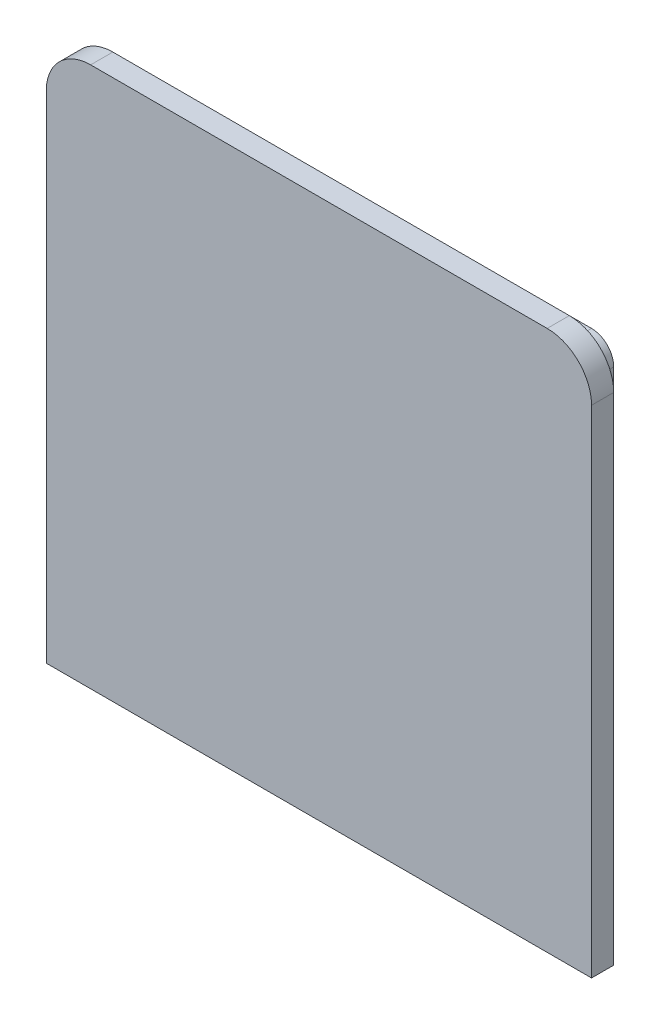
from build123d import *

# Parameters (mm, degrees)
EXTRUDE_THIN1_DEPTH = 1
FILLET1_R           = 1
BOSS_EXTRUDE3_DEPTH = 1


with BuildPart() as part:
    # Sketch2 → Extrude-Thin1 (new body)
    with BuildSketch(Plane.XY):
        Polygon((-4.715956192, 79.3220364), (1.588121174, 79.3220364), (11.573708355, 79.3220364), (17.863372902, 79.3220364), (17.863372902, 101.681701941), (11.573708355, 101.681701941), (1.588121174, 101.681701941), (-4.715956192, 101.681701941), align=None)
        Polygon((-3.715956192, 80.3220364), (1.588121174, 80.3220364), (11.573708355, 80.3220364), (16.863372902, 80.3220364), (16.863372902, 100.681701941), (11.573708355, 100.681701941), (1.588121174, 100.681701941), (-3.715956192, 100.681701941), align=None, mode=Mode.SUBTRACT)
    extrude(amount=-EXTRUDE_THIN1_DEPTH)

    # Fillet1
    fillet1_edges = [part.edges().sort_by_distance(p)[0] for p in [
        (-4.715956192, 101.681701941, -0.5),
        (17.863372902, 79.3220364, -0.5),
        (17.863372902, 101.681701941, -0.5),
        (-4.715956192, 79.3220364, -0.5),
    ]]
    fillet(fillet1_edges, radius=FILLET1_R)

    # Sketch3 → Boss-Extrude3 (add)
    with BuildSketch(Plane.XY):
        with BuildLine():
            Line((1.588121174, 78.3220364), (11.573708355, 78.3220364))
            Line((11.573708355, 78.3220364), (18.863372902, 78.3220364))
            Line((18.863372902, 78.3220364), (18.863372902, 100.681701941))
            ThreePointArc((18.863372902, 100.681701941), (18.277586464, 102.095915503), (16.863372902, 102.681701941))
            Line((16.863372902, 102.681701941), (11.573708355, 102.681701941))
            Line((11.573708355, 102.681701941), (1.588121174, 102.681701941))
            Line((1.588121174, 102.681701941), (-3.715956192, 102.681701941))
            ThreePointArc((-3.715956192, 102.681701941), (-5.130169754, 102.095915503), (-5.715956192, 100.681701941))
            Line((-5.715956192, 100.681701941), (-5.715956192, 78.3220364))
            Line((-5.715956192, 78.3220364), (1.588121174, 78.3220364))
        make_face()
    extrude(amount=BOSS_EXTRUDE3_DEPTH)


solid = part.part
